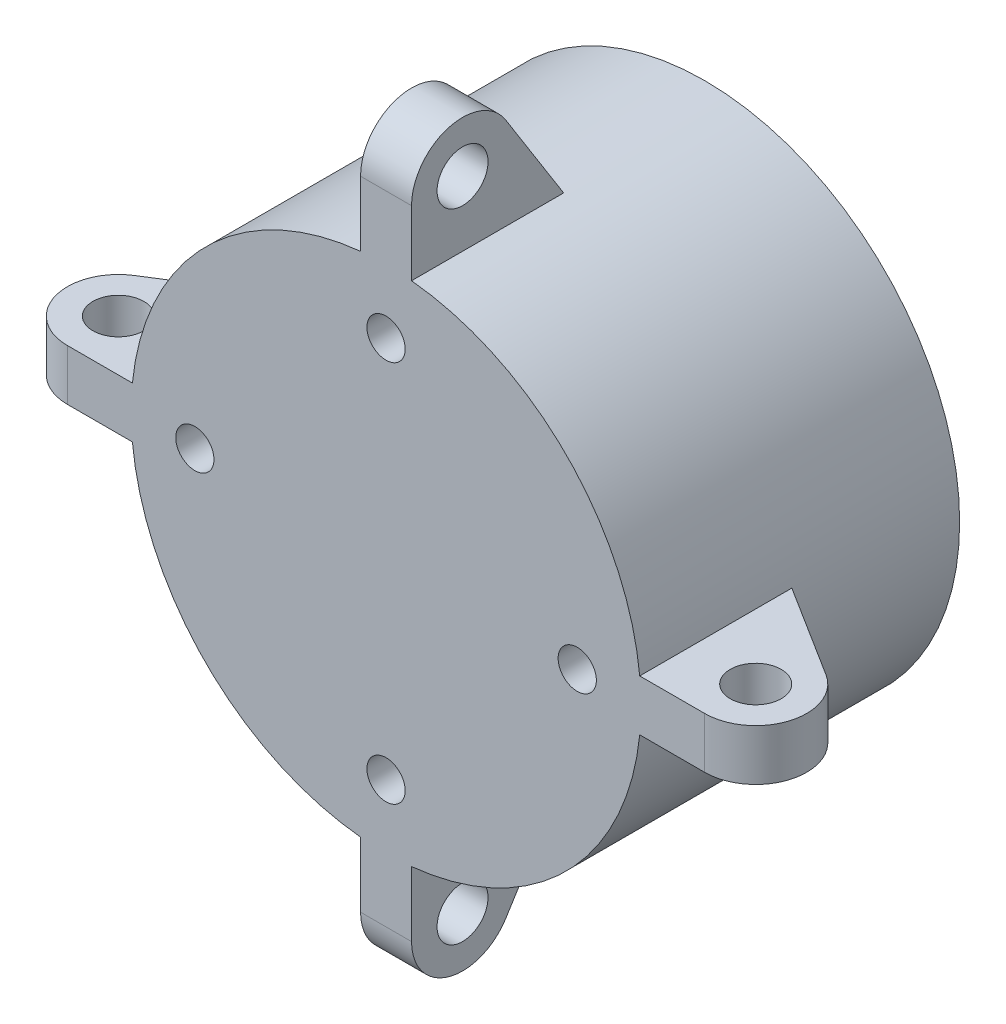
from build123d import *

# Parameters (mm, degrees)
SKETCH_1_R               = 40
EXTRUDE_1_DEPTH          = 50
SKETCH_2_R               = 3
CUT_EXTRUDE_1_DEPTH      = 10
SKETCH_3_R               = 4
EXTRUDE_2_DEPTH          = 4
PATTERN_CIRCULAR_1_COUNT = 4


with BuildPart() as part:
    # 草图1 → 凸台-拉伸1 (new body)
    with BuildSketch(Plane.XY):
        Circle(SKETCH_1_R)
    extrude(amount=-EXTRUDE_1_DEPTH)

    # 草图2 → 切除-拉伸1 (cut)
    with BuildSketch(Plane.XY):
        with Locations((0, 30)):
            Circle(SKETCH_2_R)
        with Locations((30, 0)):
            Circle(SKETCH_2_R)
        with Locations((0, -30)):
            Circle(SKETCH_2_R)
        with Locations((-30, 0)):
            Circle(SKETCH_2_R)
    extrude(amount=-CUT_EXTRUDE_1_DEPTH, mode=Mode.SUBTRACT)

    # 草图3 → 凸台-拉伸2 (add, symmetric)
    with BuildSketch(Plane(origin=(0, 0, 0), x_dir=(0, 0, -1), z_dir=(1, 0, 0))):
        with BuildLine():
            Line((25, 38), (0, 38))
            Line((0, 38), (0, 50))
            ThreePointArc((0, 50), (5.783329548, 57.686766037), (14.771593026, 54.259756787))
            Line((14.771593026, 54.259756787), (25, 38))
        make_face()
        with Locations((8, 50)):
            Circle(SKETCH_3_R, mode=Mode.SUBTRACT)
    extrude_2 = extrude(amount=EXTRUDE_2_DEPTH, both=True)

    # 阵列(圆周)1: 凸台-拉伸2 ×4 about axis
    pattern_circular_1_axis = Axis((0, 0, -50), (0, 0, 1))
    for i in range(1, PATTERN_CIRCULAR_1_COUNT):
        add(extrude_2.rotate(pattern_circular_1_axis, i * 360 / PATTERN_CIRCULAR_1_COUNT))


solid = part.part
